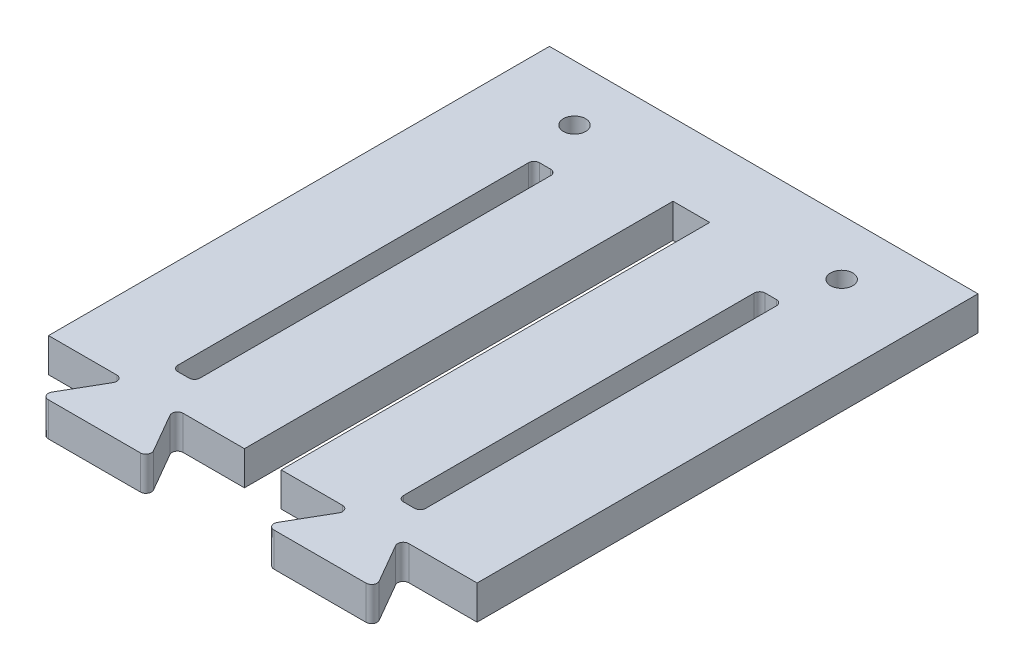
from build123d import *

# Parameters (mm, degrees)
BOSS_EXTRUDE1_DEPTH      = 3.05
FILLET1_R                = 0.5
SKETCH3_W                = 3.3
SKETCH3_H                = 40
SKETCH3_H_2              = 1
CUT_EXTRUDE2_DEPTH       = 50.039422917
SKETCH8_W                = 2
SKETCH8_H                = 32.5
CUT_EXTRUDE3_DEPTH       = 50.039422917
FILLET2_R                = 0.5
M3_TAPPED_DAMPER_HOLES_D = 2


with BuildPart() as part:
    # Sketch1 → Boss-Extrude1 (new body)
    with BuildSketch(Plane(origin=(0, 0, 0), x_dir=(1, 0, 0), z_dir=(0, 1, 0))):
        Polygon((-19.25, 0), (-19.25, 45), (19.25, 45), (19.25, 0), (12.25, 0), (15.136751346, -5), (5.136751346, -5), (8.023502692, 0), (-8.023502692, 0), (-5.136751346, -5), (-15.136751346, -5), (-12.25, 0), align=None)
    extrude(amount=BOSS_EXTRUDE1_DEPTH)

    # Fillet1
    fillet1_edges = [part.edges().sort_by_distance(p)[0] for p in [
        (12.25, 1.525, 0),
        (15.136751346, 1.525, 5),
        (5.136751346, 1.525, 5),
        (8.023502692, 1.525, 0),
        (-8.023502692, 1.525, 0),
        (-5.136751346, 1.525, 5),
        (-15.136751346, 1.525, 5),
        (-12.25, 1.525, 0),
    ]]
    fillet(fillet1_edges, radius=FILLET1_R)

    # Sketch3 → Cut-Extrude2 (cut, through all)
    with BuildSketch(Plane(origin=(0, 3.05, 0), x_dir=(1, 0, 0), z_dir=(0, 1, 0))):
        with Locations((0, 18.5)):
            Rectangle(SKETCH3_W, SKETCH3_H)
        with Locations((0, -3.2)):
            Rectangle(SKETCH3_W, SKETCH3_H_2)
    extrude(amount=-CUT_EXTRUDE2_DEPTH, mode=Mode.SUBTRACT)

    # Sketch8 → Cut-Extrude3 (cut, through all)
    with BuildSketch(Plane(origin=(0, 3.05, 0), x_dir=(1, 0, 0), z_dir=(0, 1, 0))):
        with Locations((-10.136751346, 19.25)):
            Rectangle(SKETCH8_W, SKETCH8_H)
        with Locations((10.136751346, 19.25)):
            Rectangle(SKETCH8_W, SKETCH8_H)
    extrude(amount=-CUT_EXTRUDE3_DEPTH, mode=Mode.SUBTRACT)

    # Fillet2
    fillet2_edges = [part.edges().sort_by_distance(p)[0] for p in [
        (11.136751346, 1.525, -3),
        (9.136751346, 1.525, -3),
        (11.136751346, 1.525, -35.5),
        (9.136751346, 1.525, -35.5),
        (-9.136751346, 1.525, -3),
        (-9.136751346, 1.525, -35.5),
        (-11.136751346, 1.525, -35.5),
        (-11.136751346, 1.525, -3),
    ]]
    fillet(fillet2_edges, radius=FILLET2_R)

    # M3 Tapped Damper Holes (through all)
    with Locations(Plane(origin=(0, 3.05, 0), x_dir=(1, 0, 0), z_dir=(0, 1, 0))):
        with Locations((-12, 40), (12, 40)):
            Hole(M3_TAPPED_DAMPER_HOLES_D / 2)


solid = part.part
